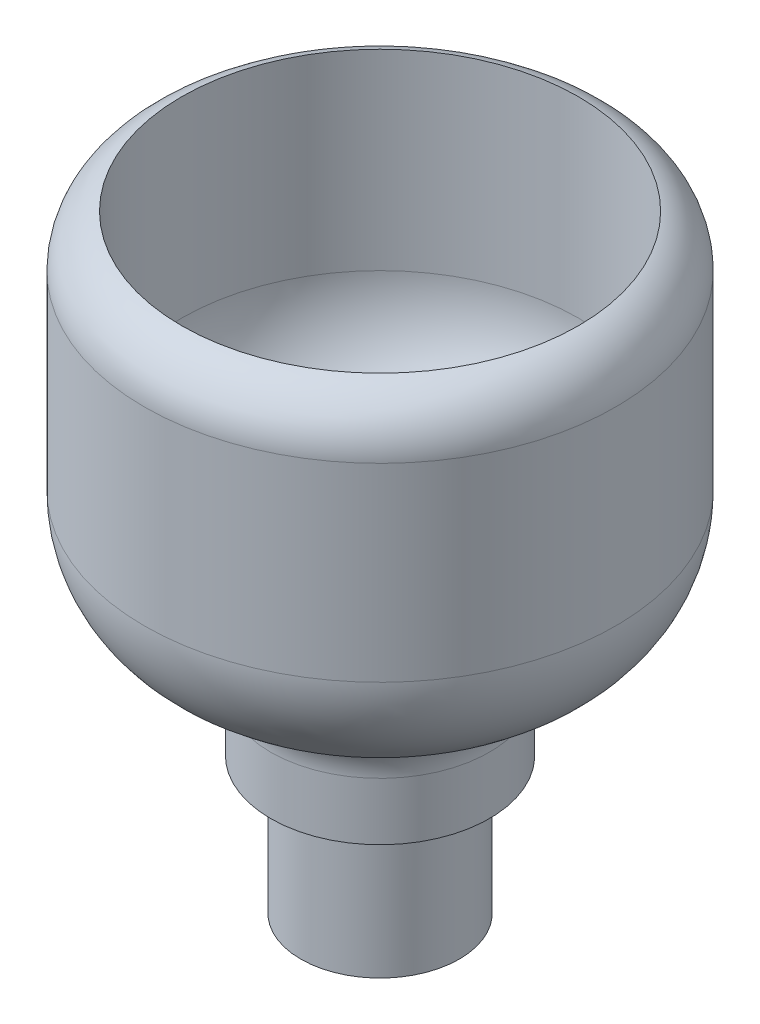
from build123d import *

# Parameters (mm, degrees)
FILLET2_R           = 2
FILLET5_R           = 2
SKETCH4_R           = 2.9
SKETCH4_R_2         = 2.8
BOSS_EXTRUDE1_DEPTH = 5


with BuildPart() as part:
    # Sketch1 → Revolve1 (revolve)
    with BuildSketch(Plane.XY, mode=Mode.PRIVATE) as revolve1_sk:
        with BuildLine():
            Line((2.8, 5.768459657), (2.8, 11.536919315))
            ThreePointArc((2.8, 11.536919315), (5.949994158, 12.841689616), (7.254764459, 15.991683774))
            Line((7.254764459, 15.991683774), (7.254764459, 23.002625948))
            Line((7.254764459, 23.002625948), (8.614040085, 23.002625948))
            Line((8.614040085, 23.002625948), (8.614040085, 14.175242604))
            ThreePointArc((8.614040085, 14.175242604), (7.262619033, 10.912623572), (4, 9.56120252))
            Line((4, 9.56120252), (4, 5.768459657))
            Line((4, 5.768459657), (2.8, 5.768459657))
        make_face()
    revolve(revolve1_sk.sketch.rotate(Axis((0, 81.429038173, 0), (0, -1, 0)), 90), axis=Axis((0, 81.429038173, 0), (0, -1, 0)))

    # Fillet2
    # the kernel refuses this fillet: 2 mm, written as the material it takes off along each edge
    with BuildSketch(Plane(origin=(0, 23.002625948, 0), x_dir=(0, 0, 1), z_dir=(1, 0, 0))) as fillet2_piece_1:
        with BuildLine():
            CenterArc((6.614040085, 1.894590266), FILLET2_R, 288.684829844, 71.315170156)
            Line((8.614040085, 1.894590266), (8.654040085, 1.894590266))
            Line((8.654040085, 1.894590266), (8.654040085, 0))
            Line((8.654040085, 0), (8.614040085, -0.04))
            ThreePointArc((8.614040085, -0.04), (7.934402272, -0.04), (7.267578947, -0.037891805))
            Line((7.267578947, -0.037891805), (7.254764459, 0))
        make_face()
    revolve(axis=Axis((0, 23.002625948, 0), (0, -1, 0)), mode=Mode.SUBTRACT)

    # Fillet5
    fillet5_edges = [part.edges().sort_by_distance(p)[0] for p in [
        (0, 9.56120252, -4),
    ]]
    fillet(fillet5_edges, radius=FILLET5_R)

    # Sketch4 → Boss-Extrude1 (add)
    with BuildSketch(Plane.XZ.offset(-5.768459657)):
        with Locations(Location((0, 0, 0), (0, 0, 90))):
            Circle(SKETCH4_R)
        with Locations(Location((0, 0, 0), (0, 0, 90))):
            Circle(SKETCH4_R_2, mode=Mode.SUBTRACT)
    extrude(amount=BOSS_EXTRUDE1_DEPTH)


solid = part.part
